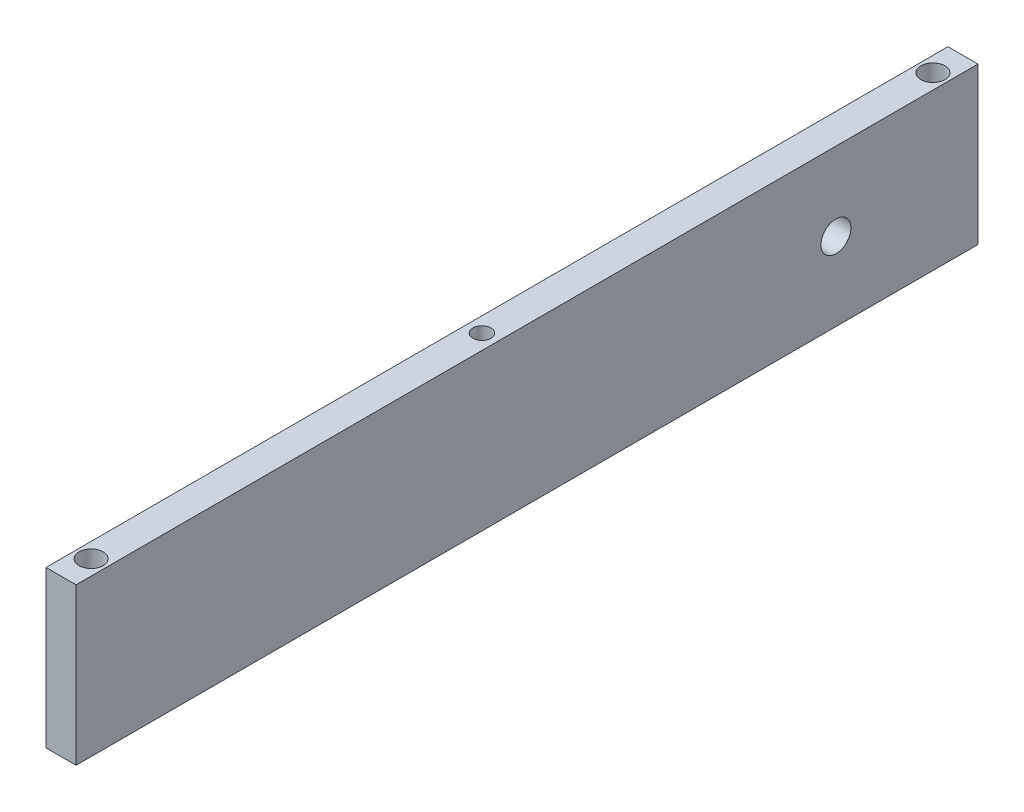
from build123d import *

# Parameters (mm, degrees)
SKETCH1_W           = 6.35
SKETCH1_H           = 33.02
BOSS_EXTRUDE1_DEPTH = 190.5
CUT_EXTRUDE1_REACH  = 195.445
SKETCH2_R           = 3.175
SKETCH3_R           = 2.54
SKETCH3_R_2         = 1.905
CUT_EXTRUDE2_DEPTH  = 194.444805823


with BuildPart() as part:
    # Sketch1 → Boss-Extrude1 (new body)
    with BuildSketch(Plane.XY):
        with Locations((-3.175, 16.51)):
            Rectangle(SKETCH1_W, SKETCH1_H)
    extrude(amount=-BOSS_EXTRUDE1_DEPTH)

    # Sketch2 → Cut-Extrude1 (cut, up to next)
    with BuildSketch(Plane.ZY.offset(6.35), mode=Mode.PRIVATE) as cut_extrude1_sk1:
        with Locations((-160.5000092, 16.51)):
            Circle(SKETCH2_R)
    cut_extrude1_tool1 = extrude(cut_extrude1_sk1.sketch, amount=-CUT_EXTRUDE1_REACH, mode=Mode.PRIVATE) & part.part
    add(cut_extrude1_tool1.solids().sort_by_distance((-6.35, 16.51, -160.500009))[0], mode=Mode.SUBTRACT)

    # Sketch3 → Cut-Extrude2 (cut, through all)
    with BuildSketch(Plane(origin=(0, 33.02, 0), x_dir=(1, 0, 0), z_dir=(0, 1, 0))):
        with Locations((-3.175, 6.35)):
            Circle(SKETCH3_R)
        with Locations((-3.175, 184.15)):
            Circle(SKETCH3_R)
        with Locations((-3.175, 88.9)):
            Circle(SKETCH3_R_2)
    extrude(amount=-CUT_EXTRUDE2_DEPTH, mode=Mode.SUBTRACT)


solid = part.part
